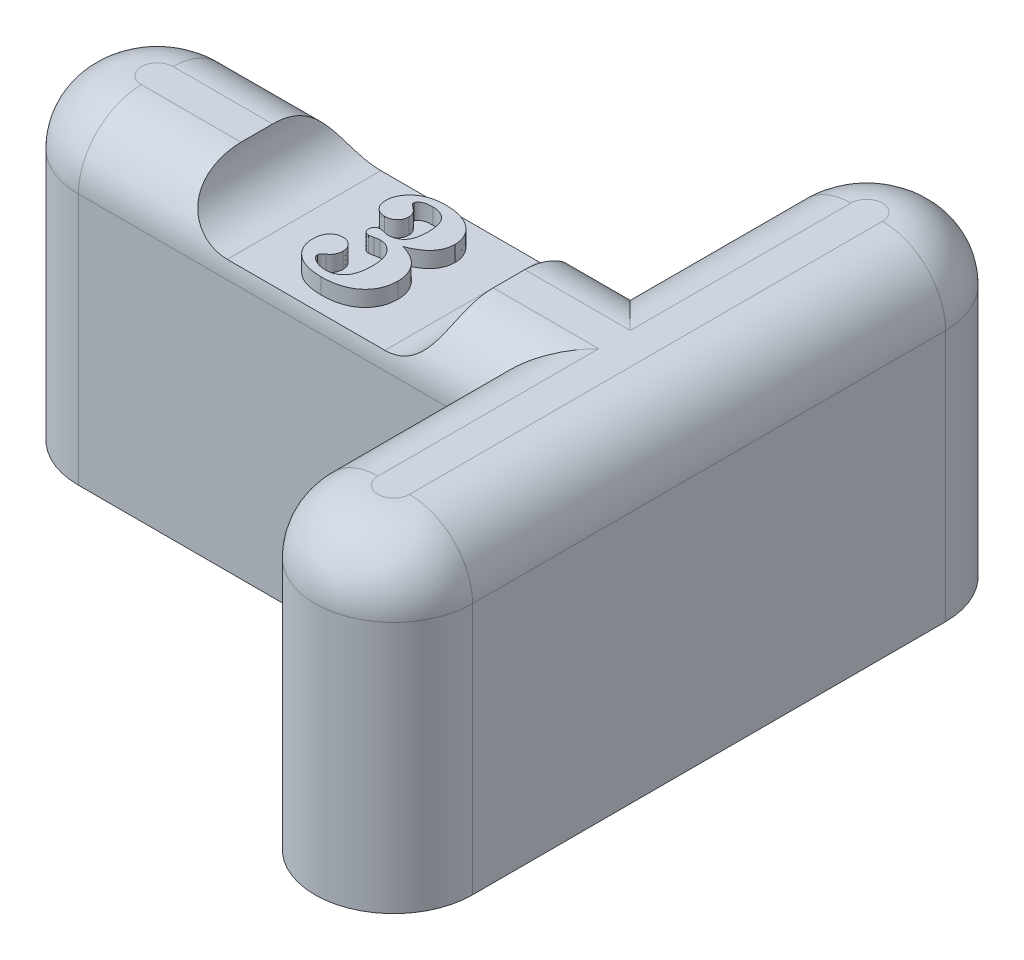
from build123d import *

# Parameters (mm, degrees)
BOSS_EXTRUDE1_DEPTH     = 20
FILLET1_R               = 4
SKETCH2_R               = 2.75
CUT_EXTRUDE1_DEPTH      = 1.5
LPATTERN1_COUNT         = 2
LPATTERN1_PITCH         = 30
CUT_EXTRUDE2_DEPTH      = 35.641016151
CUT_EXTRUDE2_DEPTH_BACK = 35.641016151
WRAP1_DEPTH             = 1


# Read off the part's stored shape, not the designer's step: Wrap1
with BuildPart() as part:
    # Sketch1 → Boss-Extrude1 (new body)
    with BuildSketch(Plane(origin=(0, 0, 0), x_dir=(1, 0, 0), z_dir=(0, 1, 0))):
        with BuildLine():
            Line((-15, -5), (10, -5))
            Line((10, -5), (10, -15))
            ThreePointArc((10, -15), (15, -20), (20, -15))
            Line((20, -15), (20, 15))
            ThreePointArc((20, 15), (15, 20), (10, 15))
            Line((10, 15), (10, 5))
            Line((10, 5), (-15, 5))
            ThreePointArc((-15, 5), (-20, 0), (-15, -5))
        make_face()
    extrude(amount=BOSS_EXTRUDE1_DEPTH)

    # Fillet1
    fillet1_edges = [part.edges().sort_by_distance(p)[0] for p in [
        (15, 20, 20),
        (20, 20, 0),
        (15, 20, -20),
        (10, 20, -10),
        (-2.5, 20, -5),
        (-20, 20, 0),
        (-2.5, 20, 5),
        (10, 20, 10),
    ]]
    fillet(fillet1_edges, radius=FILLET1_R)

    # Sketch2 → Cut-Extrude1 (cut)
    with BuildSketch(Plane.XZ):
        with Locations(Location((-15, 0, 0), (0, 0, 270))):
            Circle(SKETCH2_R)
    cut_extrude1 = extrude(amount=-CUT_EXTRUDE1_DEPTH, mode=Mode.SUBTRACT)

    # LPattern1: Cut-Extrude1 ×2
    with Locations(*[(i * LPATTERN1_PITCH, 0, 0) for i in range(1, LPATTERN1_COUNT)]):
        add(cut_extrude1, mode=Mode.SUBTRACT)

    # Sketch3 → Cut-Extrude2 (cut, two sides: drawn at the far end of the back side and taken through both)
    with BuildSketch(Plane.XY.offset(-CUT_EXTRUDE2_DEPTH_BACK)):
        with BuildLine():
            Line((4.311759309, 17), (-5.688240691, 17))
            ThreePointArc((-5.688240691, 17), (-8.688240691, 20), (-5.688240691, 23))
            Line((-5.688240691, 23), (4.311759309, 23))
            ThreePointArc((4.311759309, 23), (7.311759309, 20), (4.311759309, 17))
        make_face()
    extrude(amount=CUT_EXTRUDE2_DEPTH + CUT_EXTRUDE2_DEPTH_BACK, mode=Mode.SUBTRACT)

    # Wrap1 outline → Wrap1 (add)
    with BuildSketch(Plane(origin=(0, 17, 0), x_dir=(1, 0, 0), z_dir=(0, 1, 0))):
        with BuildLine():
            add(Edge.make_bspline(
                [(1.917763174, -1.664018894), (1.915512427, -1.743710337), (1.91109789, -1.900014431), (1.879210344, -2.129166767), (1.822826304, -2.346085079), (1.74469591, -2.551423355), (1.648407568, -2.746822638), (1.523444768, -2.92688852), (1.381228506, -3.098021691), (1.215756394, -3.254558988), (1.030987188, -3.395790686), (0.828197194, -3.519787342), (0.607267002, -3.624074487), (0.368851997, -3.708911225), (0.112944305, -3.774530613), (-0.160551885, -3.8198254), (-0.451234801, -3.849726702), (-0.651068825, -3.853028231), (-0.753711185, -3.854724022)],
                knots=[0, 0, 0, 0, 0.061354375, 0.120338389, 0.177702509, 0.233546768, 0.289283374, 0.3449562, 0.401886605, 0.460365064, 0.51992708, 0.580664812, 0.643036542, 0.707697668, 0.775236972, 0.846171603, 0.920987881, 1, 1, 1, 1], degree=3))
            add(Edge.make_bspline(
                [(0.180583686, 0.401686235), (0.250939519, 0.381447703), (0.388450802, 0.341891259), (0.583976844, 0.26482639), (0.767369552, 0.182670413), (0.936605432, 0.089162933), (1.092093901, -0.013734201), (1.236396993, -0.124306632), (1.365770914, -0.246102541), (1.481743896, -0.376736008), (1.584548822, -0.514306894), (1.672930065, -0.659509483), (1.748463986, -0.810687299), (1.811798518, -0.968480522), (1.859464946, -1.133399766), (1.892866701, -1.305046615), (1.91458301, -1.482369562), (1.91669591, -1.603057347), (1.917763174, -1.664018894)],
                knots=[0, 0, 0, 0, 0.075025699, 0.146638589, 0.215271416, 0.280976256, 0.344630791, 0.406315274, 0.467154943, 0.526516949, 0.585236113, 0.643010064, 0.700575913, 0.758349864, 0.817112444, 0.876302356, 0.937518121, 1, 1, 1, 1], degree=3))
            add(Edge.make_bspline(
                [(1.712634968, 2.170917004), (1.708348212, 2.080231644), (1.699886161, 1.901218867), (1.631284481, 1.640078878), (1.519338067, 1.394409157), (1.390526914, 1.203259611), (1.263580914, 1.060895077), (1.154467588, 0.953214848), (1.026796536, 0.854174168), (0.886902221, 0.755050129), (0.731314633, 0.661848181), (0.561855219, 0.569276173), (0.377061925, 0.481987869), (0.247079266, 0.428863309), (0.180583686, 0.401686235)],
                knots=[0, 0, 0, 0, 0.108587554, 0.214351684, 0.321241858, 0.430999345, 0.489069076, 0.549749196, 0.614451706, 0.682490285, 0.755190336, 0.831693801, 0.913899143, 1, 1, 1, 1], degree=3))
            add(Edge.make_bspline(
                [(-0.723262468, 4.042711876), (-0.600780778, 4.039691809), (-0.363433487, 4.033839469), (-0.020632765, 3.987272155), (0.296467892, 3.909609982), (0.585125154, 3.7983366), (0.845623789, 3.66323507), (1.074166014, 3.503249984), (1.270914854, 3.321910114), (1.429697072, 3.116378514), (1.555359898, 2.896654029), (1.646093961, 2.664639706), (1.703284559, 2.421546389), (1.709494354, 2.255098383), (1.712634968, 2.170917004)],
                knots=[0, 0, 0, 0, 0.10695053, 0.207250721, 0.301516556, 0.391461648, 0.476821793, 0.557207781, 0.634455968, 0.709589712, 0.783146573, 0.854802433, 0.926566069, 1, 1, 1, 1], degree=3))
            add(Edge.make_bspline(
                [(-2.444416314, 3.436942645), (-2.393872725, 3.485991809), (-2.292625391, 3.584245558), (-2.116119503, 3.705561665), (-1.924785592, 3.809844222), (-1.717361608, 3.897115505), (-1.492471301, 3.962526162), (-1.250906451, 4.007949899), (-0.992695461, 4.03769206), (-0.814694748, 4.041008398), (-0.723262468, 4.042711876)],
                knots=[0, 0, 0, 0, 0.112520394, 0.225397328, 0.341295234, 0.46082693, 0.584695833, 0.715280351, 0.853750211, 1, 1, 1, 1], degree=3))
            add(Edge.make_bspline(
                [(-2.902749647, 2.395275978), (-2.901846442, 2.442929512), (-2.900049873, 2.537717411), (-2.875466955, 2.677502652), (-2.841810466, 2.814672165), (-2.788675359, 2.946408726), (-2.724829208, 3.075668269), (-2.64535332, 3.200845962), (-2.552851965, 3.323339343), (-2.480990004, 3.398625985), (-2.444416314, 3.436942645)],
                knots=[0, 0, 0, 0, 0.122161592, 0.242992273, 0.363386459, 0.4840848, 0.606730262, 0.733038715, 0.864131742, 1, 1, 1, 1], degree=3))
            add(Edge.make_bspline(
                [(-2.056595801, 1.478609312), (-2.114114969, 1.481523737), (-2.227001341, 1.487243549), (-2.388083923, 1.537280194), (-2.535124928, 1.617963635), (-2.663988253, 1.729957183), (-2.769504594, 1.868249268), (-2.848688828, 2.026549423), (-2.893600206, 2.20536105), (-2.899623678, 2.330390241), (-2.902749647, 2.395275978)],
                knots=[0, 0, 0, 0, 0.123503177, 0.242385729, 0.359144057, 0.482175805, 0.606759678, 0.731136659, 0.860469416, 1, 1, 1, 1], degree=3))
            add(Edge.make_bspline(
                [(-1.261724006, 2.214186235), (-1.264449891, 2.163153507), (-1.269742236, 2.064072756), (-1.312591411, 1.92162109), (-1.38715783, 1.794751535), (-1.486269624, 1.683246945), (-1.606129142, 1.591141219), (-1.744256508, 1.527058995), (-1.895453878, 1.484730291), (-2.001808783, 1.480690398), (-2.056595801, 1.478609312)],
                knots=[0, 0, 0, 0, 0.126444231, 0.245493237, 0.364814777, 0.488720188, 0.613543272, 0.736823611, 0.86442892, 1, 1, 1, 1], degree=3))
            add(Edge.make_bspline(
                [(-1.691211185, 2.900083671), (-1.650573861, 2.868711759), (-1.575211481, 2.810532192), (-1.478434568, 2.719690287), (-1.401630583, 2.637360623), (-1.34624186, 2.557826852), (-1.307825423, 2.478578491), (-1.280254292, 2.396319133), (-1.263944506, 2.307245913), (-1.262477672, 2.24577189), (-1.261724006, 2.214186235)],
                knots=[0, 0, 0, 0, 0.182070801, 0.337652372, 0.470523462, 0.580943793, 0.680135151, 0.782042625, 0.888012428, 1, 1, 1, 1], degree=3))
            add(Edge.make_bspline(
                [(-1.877108621, 3.148481106), (-1.876353813, 3.12796599), (-1.874971204, 3.090387761), (-1.855341209, 3.044942707), (-1.826413696, 3.013787943), (-1.792970633, 2.98255191), (-1.747315172, 2.943085806), (-1.711145363, 2.91536266), (-1.691211185, 2.900083671)],
                knots=[0, 0, 0, 0, 0.188481556, 0.345248003, 0.443161045, 0.579238055, 0.768106505, 1, 1, 1, 1], degree=3))
            add(Edge.make_bspline(
                [(-1.054993237, 3.529891363), (-1.118091256, 3.528385902), (-1.236722971, 3.525555459), (-1.40313079, 3.504126044), (-1.545703453, 3.46634039), (-1.663933982, 3.414356877), (-1.754637779, 3.35134536), (-1.824125686, 3.28903788), (-1.868634793, 3.220553472), (-1.874412692, 3.171410764), (-1.877108621, 3.148481106)],
                knots=[0, 0, 0, 0, 0.19340588, 0.363625855, 0.512994624, 0.644183797, 0.757282422, 0.849945944, 0.929985784, 1, 1, 1, 1], degree=3))
            add(Edge.make_bspline(
                [(0.17417343, 2.028288799), (0.173525494, 2.091904889), (0.172270925, 2.215081753), (0.154864165, 2.393105439), (0.132449039, 2.558374718), (0.097575363, 2.709880125), (0.050528098, 2.846171874), (-0.003354959, 2.970103624), (-0.06968833, 3.079519084), (-0.145140092, 3.17681893), (-0.231127647, 3.260407508), (-0.324559343, 3.333154833), (-0.426275337, 3.394403702), (-0.536012075, 3.444186991), (-0.654190572, 3.483146341), (-0.780648902, 3.508985772), (-0.91498271, 3.528349465), (-1.007373924, 3.529366944), (-1.054993237, 3.529891363)],
                knots=[0, 0, 0, 0, 0.085873572, 0.166272986, 0.241360724, 0.311004539, 0.375793903, 0.435856468, 0.493138333, 0.548120936, 0.601684393, 0.654642041, 0.707717483, 0.761629576, 0.81706464, 0.875359625, 0.935759162, 1, 1, 1, 1], degree=3))
            add(Edge.make_bspline(
                [(-0.117493237, 0.898481106), (-0.093631646, 0.928312457), (-0.044483643, 0.989756447), (0.014177978, 1.097300317), (0.063313162, 1.218557147), (0.105575655, 1.352850162), (0.134257573, 1.502518239), (0.159499269, 1.664824043), (0.171030577, 1.842229488), (0.173099507, 1.964711746), (0.17417343, 2.028288799)],
                knots=[0, 0, 0, 0, 0.096159815, 0.198061519, 0.307357594, 0.425781566, 0.552299199, 0.691147288, 0.839683351, 1, 1, 1, 1], degree=3))
            add(Edge.make_bspline(
                [(-0.939608621, 0.555532388), (-0.896817205, 0.556265981), (-0.81358224, 0.557692916), (-0.692263735, 0.574276491), (-0.578185649, 0.600928714), (-0.471586621, 0.640105943), (-0.371772206, 0.688439476), (-0.277509719, 0.745783739), (-0.192521076, 0.816791951), (-0.142553972, 0.871195364), (-0.117493237, 0.898481106)],
                knots=[0, 0, 0, 0, 0.139400172, 0.271151778, 0.398277016, 0.520563852, 0.640497354, 0.759364307, 0.879310449, 1, 1, 1, 1], degree=3))
            add(Edge.make_bspline(
                [(-1.242493237, 0.61482726), (-1.186323716, 0.597416467), (-1.087381672, 0.56674753), (-0.984209726, 0.558917361), (-0.939608621, 0.555532388)],
                knots=[0, 0, 0, 0, 0.567701235, 1, 1, 1, 1], degree=3))
            add(Edge.make_bspline(
                [(-1.474865032, 0.658096491), (-1.441593999, 0.655216123), (-1.362797116, 0.648394452), (-1.286547419, 0.62711926), (-1.242493237, 0.61482726)],
                knots=[0, 0, 0, 0, 0.422237936, 1, 1, 1, 1], degree=3))
            add(Edge.make_bspline(
                [(-1.877108621, 0.289506747), (-1.876056089, 0.318483117), (-1.87406066, 0.37341759), (-1.854590802, 0.449569811), (-1.824013327, 0.514738375), (-1.779304197, 0.567875656), (-1.720858669, 0.608118925), (-1.650746879, 0.640008316), (-1.566171388, 0.653743758), (-1.506399462, 0.65659319), (-1.474865032, 0.658096491)],
                knots=[0, 0, 0, 0, 0.138834815, 0.263208175, 0.374439269, 0.481790582, 0.592071981, 0.712606806, 0.848377303, 1, 1, 1, 1], degree=3))
            add(Edge.make_bspline(
                [(-1.538967596, -0.059852227), (-1.563591139, -0.058369641), (-1.611238636, -0.055500779), (-1.679521089, -0.040680972), (-1.738562348, -0.010424452), (-1.789671992, 0.029439412), (-1.827571869, 0.082464562), (-1.858017371, 0.142555653), (-1.872973355, 0.213508249), (-1.875681674, 0.263282119), (-1.877108621, 0.289506747)],
                knots=[0, 0, 0, 0, 0.134273141, 0.259823658, 0.376868709, 0.492678997, 0.608999304, 0.728652424, 0.857033635, 1, 1, 1, 1], degree=3))
            add(Edge.make_bspline(
                [(-1.239288109, -0.011775304), (-1.270198207, -0.019093813), (-1.328039644, -0.032788789), (-1.409522423, -0.046366045), (-1.478316348, -0.057482109), (-1.520239136, -0.05912036), (-1.538967596, -0.059852227)],
                knots=[0, 0, 0, 0, 0.31333056, 0.586329099, 0.81519791, 1, 1, 1, 1], degree=3))
            add(Edge.make_bspline(
                [(-0.912365032, 0.042711876), (-0.934823701, 0.041980066), (-0.983119892, 0.040406347), (-1.06034269, 0.030358437), (-1.146807619, 0.012128491), (-1.207299666, -0.003507125), (-1.239288109, -0.011775304)],
                knots=[0, 0, 0, 0, 0.202759475, 0.436023603, 0.701766965, 1, 1, 1, 1], degree=3))
            add(Edge.make_bspline(
                [(0.276737532, -1.644788124), (0.275980896, -1.575316161), (0.274517793, -1.440978651), (0.258588141, -1.24603966), (0.23079743, -1.065969206), (0.197226143, -0.898535595), (0.147962404, -0.746319332), (0.091973076, -0.606187905), (0.021638726, -0.48173867), (-0.056283067, -0.370589578), (-0.144295804, -0.274206107), (-0.236172219, -0.18865498), (-0.335603895, -0.118227801), (-0.438422171, -0.056836329), (-0.549706232, -0.012952875), (-0.665695265, 0.019358772), (-0.787219064, 0.039242148), (-0.870089018, 0.041539754), (-0.912365032, 0.042711876)],
                knots=[0, 0, 0, 0, 0.089659443, 0.173373917, 0.252164698, 0.32478559, 0.393476985, 0.458396676, 0.519206122, 0.577557919, 0.633215921, 0.687389211, 0.739248931, 0.790220988, 0.841564769, 0.893088794, 0.94545937, 1, 1, 1, 1], degree=3))
            add(Edge.make_bspline(
                [(-1.003711185, -3.341903509), (-0.955568395, -3.340712232), (-0.861022619, -3.338372729), (-0.723527038, -3.318904635), (-0.593198317, -3.287070058), (-0.471983119, -3.240393676), (-0.358078105, -3.181868671), (-0.251210464, -3.111457363), (-0.154155507, -3.02548537), (-0.062738829, -2.929139971), (0.017128458, -2.817172117), (0.088707196, -2.692168072), (0.144367524, -2.550959181), (0.196205841, -2.398228537), (0.230756563, -2.229572031), (0.25876882, -2.04729192), (0.274441864, -1.850724129), (0.275957166, -1.714791945), (0.276737532, -1.644788124)],
                knots=[0, 0, 0, 0, 0.059792206, 0.117423613, 0.172153936, 0.226142792, 0.27838593, 0.331032237, 0.384664997, 0.439137156, 0.495692256, 0.555129784, 0.617620129, 0.683943919, 0.755285008, 0.831127377, 0.913032156, 1, 1, 1, 1], degree=3))
            add(Edge.make_bspline(
                [(-1.832236826, -3.106326586), (-1.770186161, -3.142565918), (-1.646133058, -3.215016417), (-1.44148856, -3.287105791), (-1.226520247, -3.334532367), (-1.078760774, -3.33942066), (-1.003711185, -3.341903509)],
                knots=[0, 0, 0, 0, 0.24650055, 0.492809516, 0.742389192, 1, 1, 1, 1], degree=3))
            add(Edge.make_bspline(
                [(-2.082236826, -2.752159919), (-2.078949559, -2.784250956), (-2.072198029, -2.850160887), (-2.02001433, -2.943601995), (-1.938967106, -3.030811762), (-1.869662334, -3.079846934), (-1.832236826, -3.106326586)],
                knots=[0, 0, 0, 0, 0.212636247, 0.436721323, 0.695821952, 1, 1, 1, 1], degree=3))
            add(Edge.make_bspline(
                [(-1.851467596, -2.457288124), (-1.875953941, -2.474994191), (-1.919903856, -2.506774356), (-1.979961651, -2.548384126), (-2.018978182, -2.587810584), (-2.05582683, -2.625466377), (-2.079089088, -2.681499124), (-2.081132902, -2.727378897), (-2.082236826, -2.752159919)],
                knots=[0, 0, 0, 0, 0.230116423, 0.41303007, 0.553895719, 0.651787808, 0.811920297, 1, 1, 1, 1], degree=3))
            add(Edge.make_bspline(
                [(-1.466852211, -1.748954791), (-1.468180587, -1.785341369), (-1.470775342, -1.856416327), (-1.488227272, -1.960068423), (-1.519549998, -2.057166455), (-1.561149903, -2.149694519), (-1.616130719, -2.236085601), (-1.682341753, -2.317311637), (-1.761827056, -2.391177304), (-1.821100556, -2.43489212), (-1.851467596, -2.457288124)],
                knots=[0, 0, 0, 0, 0.129765424, 0.253474568, 0.373369941, 0.492719229, 0.614282922, 0.737462889, 0.865496811, 1, 1, 1, 1], degree=3))
            add(Edge.make_bspline(
                [(-2.245698365, -0.98292915), (-2.19098742, -0.985834453), (-2.084821953, -0.991472134), (-1.932890471, -1.031241112), (-1.798030746, -1.102649828), (-1.681555007, -1.199141876), (-1.58488943, -1.314973168), (-1.517098288, -1.448318466), (-1.472583992, -1.593884419), (-1.468799819, -1.696263279), (-1.466852211, -1.748954791)],
                knots=[0, 0, 0, 0, 0.134279191, 0.260566015, 0.381986206, 0.505901784, 0.629817363, 0.749468442, 0.87105847, 1, 1, 1, 1], degree=3))
            add(Edge.make_bspline(
                [(-3.107877852, -2.019788124), (-3.105746055, -1.943104606), (-3.101676085, -1.796702516), (-3.053658659, -1.590429822), (-2.979419097, -1.408536872), (-2.872213078, -1.256148898), (-2.741660603, -1.135062843), (-2.592611386, -1.045481079), (-2.42436883, -0.99257078), (-2.306437925, -0.986206851), (-2.245698365, -0.98292915)],
                knots=[0, 0, 0, 0, 0.151527419, 0.28929203, 0.416768361, 0.538233618, 0.654975674, 0.766880183, 0.879933125, 1, 1, 1, 1], degree=3))
            add(Edge.make_bspline(
                [(-0.753711185, -3.854724022), (-0.844585247, -3.853304782), (-1.021325742, -3.85054451), (-1.278816507, -3.825730412), (-1.520898053, -3.78738291), (-1.746584527, -3.728380455), (-1.957299624, -3.657187688), (-2.152856745, -3.569205204), (-2.330991141, -3.462633563), (-2.493407478, -3.342641702), (-2.637576324, -3.209574417), (-2.76367993, -3.06641039), (-2.86983405, -2.913515607), (-2.957014066, -2.752309167), (-3.025464248, -2.582022572), (-3.072748953, -2.402197081), (-3.102613721, -2.213625131), (-3.106104897, -2.085072277), (-3.107877852, -2.019788124)],
                knots=[0, 0, 0, 0, 0.081203508, 0.157932285, 0.231010373, 0.300029536, 0.366164379, 0.429625425, 0.491284509, 0.551349815, 0.609805188, 0.666309249, 0.721540184, 0.775802975, 0.82979833, 0.885159131, 0.941679328, 1, 1, 1, 1], degree=3))
        make_face()
    extrude(amount=WRAP1_DEPTH)


solid = part.part
